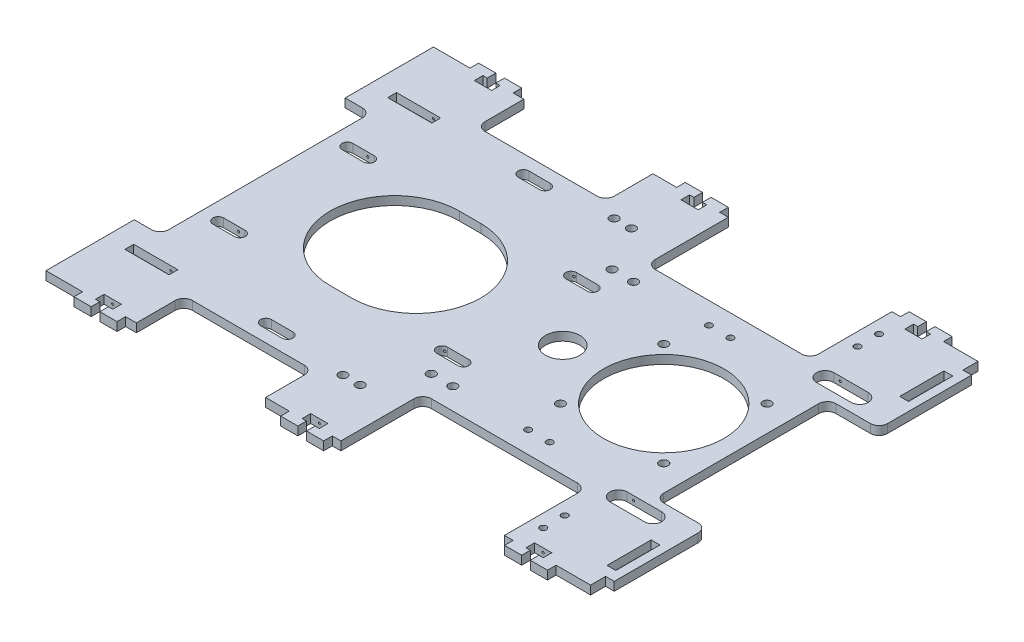
from build123d import *

# Parameters (mm, degrees)
SKETCH_1_R             = 28
SKETCH_1_R_2           = 2
SKETCH_1_R_3           = 8
SKETCH_1_R_4           = 1.5
SKETCH_1_W             = 20.5
SKETCH_1_H             = 4.1
SKETCH_1_W_2           = 4.1
SKETCH_1_H_2           = 20.5
SM_BASE_FLANGE_1_DEPTH = 4
SKETCH_2_R             = 0.5
CUT_EXTRUDE_1_DEPTH    = 314.791331939


# Sheet-metal steps are written as plain solids
with BuildPart() as part:
    # Sketch 1 → Базовая кромка1 (new body)
    with BuildSketch(Plane(origin=(0, 0, 0), x_dir=(1, 0, 0), z_dir=(0, 1, 0))):
        with BuildLine():
            Line((0, 0), (17, 0))
            Line((17, 0), (17, 4))
            Line((17, 4), (25, 4))
            Line((25, 4), (25, 0))
            Line((25, 0), (23, 0))
            Line((23, 0), (23, -4))
            Line((23, -4), (31, -4))
            Line((31, -4), (31, 0))
            Line((31, 0), (29, 0))
            Line((29, 0), (29, 4))
            Line((29, 4), (37, 4))
            Line((37, 4), (37, 0))
            Line((37, 0), (42, 0))
            Line((42, 0), (42, -18))
            ThreePointArc((42, -18), (43.171572875, -20.828427125), (46, -22))
            Line((46, -22), (98, -22))
            ThreePointArc((98, -22), (100.828427125, -20.828427125), (102, -18))
            Line((102, -18), (102, 0))
            Line((102, 0), (113, 0))
            Line((113, 0), (113, 4))
            Line((113, 4), (121, 4))
            Line((121, 4), (121, 0))
            Line((121, 0), (119, 0))
            Line((119, 0), (119, -4))
            Line((119, -4), (127, -4))
            Line((127, -4), (127, 0))
            Line((127, 0), (125, 0))
            Line((125, 0), (125, 4))
            Line((125, 4), (133, 4))
            Line((133, 4), (133, 0))
            Line((133, 0), (137, 0))
            Line((137, 0), (137, -34))
            ThreePointArc((137, -34), (138.171572875, -36.828427125), (141, -38))
            Line((141, -38), (209, -38))
            ThreePointArc((209, -38), (211.828427125, -36.828427125), (213, -34))
            Line((213, -34), (213, 0))
            Line((213, 0), (217, 0))
            Line((217, 0), (217, 4))
            Line((217, 4), (225, 4))
            Line((225, 4), (225, 0))
            Line((225, 0), (223, 0))
            Line((223, 0), (223, -4))
            Line((223, -4), (231, -4))
            Line((231, -4), (231, 0))
            Line((231, 0), (229, 0))
            Line((229, 0), (229, 4))
            Line((229, 4), (237, 4))
            Line((237, 4), (237, 0))
            Line((237, 0), (253, 0))
            Line((253, 0), (253, -7))
            Line((253, -7), (257, -7))
            Line((257, -7), (257, -46))
            ThreePointArc((257, -46), (255.828427125, -48.828427125), (253, -50))
            Line((253, -50), (237, -50))
            ThreePointArc((237, -50), (234.171572875, -51.171572875), (233, -54))
            Line((233, -54), (233, -126))
            ThreePointArc((233, -126), (234.171572875, -128.828427125), (237, -130))
            Line((237, -130), (253, -130))
            ThreePointArc((253, -130), (255.828427125, -131.171572875), (257, -134))
            Line((257, -134), (257, -173))
            Line((257, -173), (253, -173))
            Line((253, -173), (253, -180))
            Line((253, -180), (237, -180))
            Line((237, -180), (237, -184))
            Line((237, -184), (229, -184))
            Line((229, -184), (229, -180))
            Line((229, -180), (231, -180))
            Line((231, -180), (231, -176))
            Line((231, -176), (223, -176))
            Line((223, -176), (223, -180))
            Line((223, -180), (225, -180))
            Line((225, -180), (225, -184))
            Line((225, -184), (217, -184))
            Line((217, -184), (217, -180))
            Line((217, -180), (213, -180))
            Line((213, -180), (213, -146))
            ThreePointArc((213, -146), (211.828427125, -143.171572875), (209, -142))
            Line((209, -142), (141, -142))
            ThreePointArc((141, -142), (138.171572875, -143.171572875), (137, -146))
            Line((137, -146), (137, -180))
            Line((137, -180), (133, -180))
            Line((133, -180), (133, -184))
            Line((133, -184), (125, -184))
            Line((125, -184), (125, -180))
            Line((125, -180), (127, -180))
            Line((127, -180), (127, -176))
            Line((127, -176), (119, -176))
            Line((119, -176), (119, -180))
            Line((119, -180), (121, -180))
            Line((121, -180), (121, -184))
            Line((121, -184), (113, -184))
            Line((113, -184), (113, -180))
            Line((113, -180), (102, -180))
            Line((102, -180), (102, -162))
            ThreePointArc((102, -162), (100.828427125, -159.171572875), (98, -158))
            Line((98, -158), (46, -158))
            ThreePointArc((46, -158), (43.171572875, -159.171572875), (42, -162))
            Line((42, -162), (42, -180))
            Line((42, -180), (37, -180))
            Line((37, -180), (37, -184))
            Line((37, -184), (29, -184))
            Line((29, -184), (29, -180))
            Line((29, -180), (31, -180))
            Line((31, -180), (31, -176))
            Line((31, -176), (23, -176))
            Line((23, -176), (23, -180))
            Line((23, -180), (25, -180))
            Line((25, -180), (25, -184))
            Line((25, -184), (17, -184))
            Line((17, -184), (17, -180))
            Line((17, -180), (0, -180))
            Line((0, -180), (0, -139))
            Line((0, -139), (8, -139))
            ThreePointArc((8, -139), (10.828427125, -137.828427125), (12, -135))
            Line((12, -135), (12, -45))
            ThreePointArc((12, -45), (10.828427125, -42.171572875), (8, -41))
            Line((8, -41), (0, -41))
            Line((0, -41), (0, 0))
        make_face()
        with Locations(Location((197, -90, 0), (0, 0, 270))):
            Circle(SKETCH_1_R, mode=Mode.SUBTRACT)
        with Locations(Location((173, -66, 0), (0, 0, 270))):
            Circle(SKETCH_1_R_2, mode=Mode.SUBTRACT)
        with Locations(Location((221, -66, 0), (0, 0, 270))):
            Circle(SKETCH_1_R_2, mode=Mode.SUBTRACT)
        with Locations(Location((140.985169016, -48, 0), (0, 0, 90))):
            Circle(SKETCH_1_R_2, mode=Mode.SUBTRACT)
        with Locations(Location((130.985169016, -48, 0), (0, 0, 90))):
            Circle(SKETCH_1_R_2, mode=Mode.SUBTRACT)
        with Locations(Location((118.961524227, -27, 0), (0, 0, 90))):
            Circle(SKETCH_1_R_2, mode=Mode.SUBTRACT)
        with Locations(Location((110.961524227, -27, 0), (0, 0, 90))):
            Circle(SKETCH_1_R_2, mode=Mode.SUBTRACT)
        with Locations(Location((110.961524227, -153, 0), (0, 0, 270))):
            Circle(SKETCH_1_R_2, mode=Mode.SUBTRACT)
        with Locations(Location((118.961524227, -153, 0), (0, 0, 270))):
            Circle(SKETCH_1_R_2, mode=Mode.SUBTRACT)
        with Locations(Location((130.985169016, -132, 0), (0, 0, 270))):
            Circle(SKETCH_1_R_2, mode=Mode.SUBTRACT)
        with Locations(Location((140.985169016, -132, 0), (0, 0, 270))):
            Circle(SKETCH_1_R_2, mode=Mode.SUBTRACT)
        with Locations(Location((221, -114, 0), (0, 0, 90))):
            Circle(SKETCH_1_R_2, mode=Mode.SUBTRACT)
        with Locations(Location((173, -114, 0), (0, 0, 90))):
            Circle(SKETCH_1_R_2, mode=Mode.SUBTRACT)
        with Locations(Location((150.06244981, -90, 0), (0, 0, 270))):
            Circle(SKETCH_1_R_3, mode=Mode.SUBTRACT)
        with Locations(Location((219, -12, 0), (0, 0, 270))):
            Circle(SKETCH_1_R_4, mode=Mode.SUBTRACT)
        with Locations(Location((219, -22, 0), (0, 0, 270))):
            Circle(SKETCH_1_R_4, mode=Mode.SUBTRACT)
        with Locations(Location((219, -158, 0), (0, 0, 90))):
            Circle(SKETCH_1_R_4, mode=Mode.SUBTRACT)
        with Locations(Location((219, -168, 0), (0, 0, 90))):
            Circle(SKETCH_1_R_4, mode=Mode.SUBTRACT)
        with Locations(Location((176, -132, 0), (0, 0, 270))):
            Circle(SKETCH_1_R_4, mode=Mode.SUBTRACT)
        with Locations(Location((186, -132, 0), (0, 0, 270))):
            Circle(SKETCH_1_R_4, mode=Mode.SUBTRACT)
        with Locations(Location((186, -48, 0), (0, 0, 90))):
            Circle(SKETCH_1_R_4, mode=Mode.SUBTRACT)
        with Locations(Location((176, -48, 0), (0, 0, 90))):
            Circle(SKETCH_1_R_4, mode=Mode.SUBTRACT)
        with Locations((20, -28.95)):
            Rectangle(SKETCH_1_W, SKETCH_1_H, mode=Mode.SUBTRACT)
        with BuildLine():
            Line((72, -60), (82, -60))
            ThreePointArc((82, -60), (112, -90), (82, -120))
            Line((82, -120), (72, -120))
            ThreePointArc((72, -120), (42, -90), (72, -60))
        make_face(mode=Mode.SUBTRACT)
        with BuildLine():
            Line((20.038475773, -57.5), (30.038475773, -57.5))
            ThreePointArc((30.038475773, -57.5), (32.538475773, -60), (30.038475773, -62.5))
            Line((30.038475773, -62.5), (20.038475773, -62.5))
            ThreePointArc((20.038475773, -62.5), (17.538475773, -60), (20.038475773, -57.5))
        make_face(mode=Mode.SUBTRACT)
        with BuildLine():
            Line((133.959888942, -57.4967321), (123.959891078, -57.503268968))
            ThreePointArc((123.959891078, -57.503268968), (121.461525829, -60.004902651), (123.963159512, -62.5032679))
            Line((123.963159512, -62.5032679), (133.963157376, -62.496731032))
            ThreePointArc((133.963157376, -62.496731032), (136.461522625, -59.995097349), (133.959888942, -57.4967321))
        make_face(mode=Mode.SUBTRACT)
        with BuildLine():
            Line((20.038475773, -122.5), (30.038475773, -122.5))
            ThreePointArc((30.038475773, -122.5), (32.538475773, -120), (30.038475773, -117.5))
            Line((30.038475773, -117.5), (20.038475773, -117.5))
            ThreePointArc((20.038475773, -117.5), (17.538475773, -120), (20.038475773, -122.5))
        make_face(mode=Mode.SUBTRACT)
        with BuildLine():
            Line((82, -32.708696284), (72, -32.708696284))
            ThreePointArc((72, -32.708696284), (69.5, -30.208696284), (72, -27.708696284))
            Line((72, -27.708696284), (82, -27.708696284))
            ThreePointArc((82, -27.708696284), (84.5, -30.208696284), (82, -32.708696284))
        make_face(mode=Mode.SUBTRACT)
        with BuildLine():
            Line((224, -38), (240, -38))
            ThreePointArc((240, -38), (244, -42), (240, -46))
            Line((240, -46), (224, -46))
            ThreePointArc((224, -46), (220, -42), (224, -38))
        make_face(mode=Mode.SUBTRACT)
        with BuildLine():
            Line((133.959888942, -122.5032679), (123.959891078, -122.496731032))
            ThreePointArc((123.959891078, -122.496731032), (121.461525829, -119.995097349), (123.963159512, -117.4967321))
            Line((123.963159512, -117.4967321), (133.963157376, -117.503268968))
            ThreePointArc((133.963157376, -117.503268968), (136.461522625, -120.004902651), (133.959888942, -122.5032679))
        make_face(mode=Mode.SUBTRACT)
        with Locations((250.95, -22)):
            Rectangle(SKETCH_1_W_2, SKETCH_1_H_2, mode=Mode.SUBTRACT)
        with BuildLine():
            Line((82, -147.291303716), (72, -147.291303716))
            ThreePointArc((72, -147.291303716), (69.5, -149.791303716), (72, -152.291303716))
            Line((72, -152.291303716), (82, -152.291303716))
            ThreePointArc((82, -152.291303716), (84.5, -149.791303716), (82, -147.291303716))
        make_face(mode=Mode.SUBTRACT)
        with BuildLine():
            Line((224, -142), (240, -142))
            ThreePointArc((240, -142), (244, -138), (240, -134))
            Line((240, -134), (224, -134))
            ThreePointArc((224, -134), (220, -138), (224, -142))
        make_face(mode=Mode.SUBTRACT)
        with Locations((250.95, -158)):
            Rectangle(SKETCH_1_W_2, SKETCH_1_H_2, mode=Mode.SUBTRACT)
        with Locations((20, -151.05)):
            Rectangle(SKETCH_1_W, SKETCH_1_H, mode=Mode.SUBTRACT)
    extrude(amount=-SM_BASE_FLANGE_1_DEPTH)

    # Sketch 2 → Вырез-Вытянуть1 (cut, through all)
    with BuildSketch(Plane.XY.offset(176)):
        with Locations((27, -2)):
            Circle(SKETCH_2_R)
        with Locations((123, -2)):
            Circle(SKETCH_2_R)
        with Locations((227, -2)):
            Circle(SKETCH_2_R)
    extrude(amount=-CUT_EXTRUDE_1_DEPTH, mode=Mode.SUBTRACT)


solid = part.part
